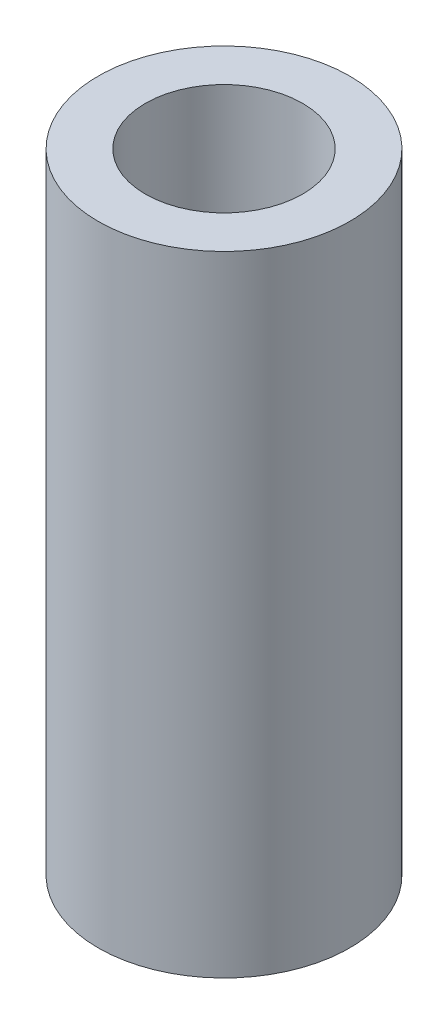
from build123d import *

# Parameters (mm, degrees)
SKETCH1_R           = 2
BOSS_EXTRUDE1_DEPTH = 10
SKETCH2_R           = 1.25
CUT_EXTRUDE1_DEPTH  = 11.392304845


with BuildPart() as part:
    # Sketch1 → Boss-Extrude1 (new body)
    with BuildSketch(Plane(origin=(0, 0, 0), x_dir=(1, 0, 0), z_dir=(0, 1, 0))):
        Circle(SKETCH1_R)
    extrude(amount=BOSS_EXTRUDE1_DEPTH)

    # Sketch2 → Cut-Extrude1 (cut, through all)
    with BuildSketch(Plane.XZ):
        Circle(SKETCH2_R)
    extrude(amount=-CUT_EXTRUDE1_DEPTH, mode=Mode.SUBTRACT)


solid = part.part
